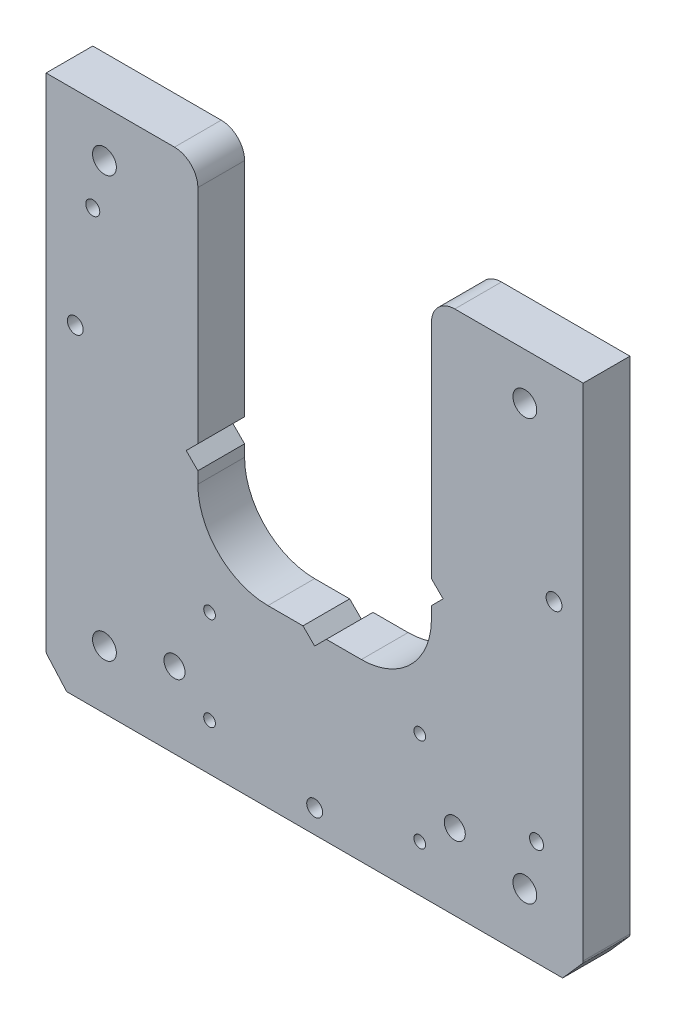
from build123d import *

# Parameters (mm, degrees)
BOSS_EXTRUDE2_DEPTH          = 20
CUT_EXTRUDE2_DEPTH           = 260.084928161
F_5_0_5_DIAMETER_HOLE2_D     = 5
F_5_0_5_DIAMETER_HOLE2_DEPTH = 15
F_5_0_5_DIAMETER_HOLE2_TIP   = 1.502151548
F_6_0_6_DIAMETER_HOLE2_D     = 6
F_10_2_10_2_DIAMETER_HOLE2_D = 10.2
F_15_0_15_DIAMETER_HOLE2_D   = 15
F_6_8_6_8_DIAMETER_HOLE2_D   = 6.8
F_9_0_9_DIAMETER_HOLE2_D     = 9
SKETCH32_R                   = 300
SKETCH32_W                   = 230
SKETCH32_H                   = 230
CUT_EXTRUDE3_DEPTH           = 260.084928161


with BuildPart() as part:
    # Sketch18 → Boss-Extrude2 (new body)
    with BuildSketch(Plane(origin=(0, 0, 0), x_dir=(-1, 0, 0), z_dir=(0, 0, -1))):
        with BuildLine():
            Line((20, -40), (-20, -40))
            ThreePointArc((-20, -40), (-41.213203436, -31.213203436), (-50, -10))
            Line((-50, -10), (-50, -5))
            Line((-50, -5), (-55, 0))
            Line((-55, 0), (-50, 5))
            Line((-50, 5), (-50, 100))
            ThreePointArc((-50, 100), (-52.928932188, 107.071067812), (-60, 110))
            Line((-60, 110), (-165, 110))
            ThreePointArc((-165, 110), (-172.071067812, 107.071067812), (-175, 100))
            Line((-175, 100), (-175, 40))
            ThreePointArc((-175, 40), (-172.071067812, 32.928932188), (-165, 30))
            Line((-165, 30), (-155, 30))
            ThreePointArc((-155, 30), (-126.715728753, 18.284271247), (-115, -10))
            Line((-115, -10), (-115, -104.24379092))
            ThreePointArc((-115, -104.24379092), (-114.870742021, -104.951126971), (-114.499675711, -105.567034195))
            Line((-114.499675711, -105.567034195), (-40.597138287, -189.323243274))
            ThreePointArc((-40.597138287, -189.323243274), (-39.920114828, -189.822976488), (-39.097462577, -190))
            Line((-39.097462577, -190), (39.097462577, -190))
            ThreePointArc((39.097462577, -190), (39.920114828, -189.822976488), (40.597138287, -189.323243274))
            Line((40.597138287, -189.323243274), (114.499675711, -105.567034195))
            ThreePointArc((114.499675711, -105.567034195), (114.870742021, -104.951126971), (115, -104.24379092))
            Line((115, -104.24379092), (115, -10))
            ThreePointArc((115, -10), (126.715728753, 18.284271247), (155, 30))
            Line((155, 30), (165, 30))
            ThreePointArc((165, 30), (172.071067812, 32.928932188), (175, 40))
            Line((175, 40), (175, 100))
            ThreePointArc((175, 100), (172.071067812, 107.071067812), (165, 110))
            Line((165, 110), (60, 110))
            ThreePointArc((60, 110), (52.928932188, 107.071067812), (50, 100))
            Line((50, 100), (50, 5))
            Line((50, 5), (55, 0))
            Line((55, 0), (50, -5))
            Line((50, -5), (50, -10))
            ThreePointArc((50, -10), (41.213203436, -31.213203436), (20, -40))
        make_face()
    extrude(amount=-BOSS_EXTRUDE2_DEPTH)

    # Sketch19 → Cut-Extrude2 (cut, through all)
    with BuildSketch(Plane(origin=(0, 0, 0), x_dir=(-1, 0, 0), z_dir=(0, 0, -1))):
        Polygon((-5, -40), (0, -45), (5, -40), align=None)
    extrude(amount=-CUT_EXTRUDE2_DEPTH, mode=Mode.SUBTRACT)

    # Ø5.0 (5) Diameter Hole2
    with Locations(Plane.XY.offset(20)):
        with Locations((45, -55), (-45, -55), (-45, -95), (45, -95)):
            Hole(F_5_0_5_DIAMETER_HOLE2_D / 2, depth=F_5_0_5_DIAMETER_HOLE2_DEPTH)
            with Locations((0, 0, -(F_5_0_5_DIAMETER_HOLE2_DEPTH + F_5_0_5_DIAMETER_HOLE2_TIP / 2))):  # 118° drill point
                Cone(0, F_5_0_5_DIAMETER_HOLE2_D / 2, F_5_0_5_DIAMETER_HOLE2_TIP, mode=Mode.SUBTRACT)

    # Ø6.0 (6) Diameter Hole2 (through all)
    with Locations(Plane(origin=(0, 0, 0), x_dir=(-1, 0, 0), z_dir=(0, 0, -1))):
        with Locations((95, 70), (-95, -70)):
            Hole(F_6_0_6_DIAMETER_HOLE2_D / 2)

    # Ø10.2 (10.2) Diameter Hole2 (through all)
    with Locations(Plane(origin=(0, 0, 0), x_dir=(-1, 0, 0), z_dir=(0, 0, -1))):
        with Locations((-90, -90), (90, -90), (-90, 90), (90, 90)):
            Hole(F_10_2_10_2_DIAMETER_HOLE2_D / 2)

    # Ø15.0 (15) Diameter Hole2 (through all)
    with Locations(Plane(origin=(0, 0, 0), x_dir=(-1, 0, 0), z_dir=(0, 0, -1))):
        with Locations((0, -150), (-135, 60), (135, 60)):
            Hole(F_15_0_15_DIAMETER_HOLE2_D / 2)

    # Ø6.8 (6.8) Diameter Hole2 (through all)
    with Locations(Plane(origin=(0, 0, 0), x_dir=(-1, 0, 0), z_dir=(0, 0, -1))):
        with Locations((102.5, 22.75), (0, -105), (-102.5, 22.75)):
            Hole(F_6_8_6_8_DIAMETER_HOLE2_D / 2)

    # Ø9.0 (9) Diameter Hole2 (through all)
    with Locations(Plane(origin=(0, 0, 0), x_dir=(-1, 0, 0), z_dir=(0, 0, -1))):
        with Locations((60, -82.5), (-60, -82.5), (120, 95), (-120, 95)):
            Hole(F_9_0_9_DIAMETER_HOLE2_D / 2)

    # Sketch32 → Cut-Extrude3 (cut, through all)
    with BuildSketch(Plane.XY):
        Circle(SKETCH32_R)
        Rectangle(SKETCH32_W, SKETCH32_H, mode=Mode.SUBTRACT)
    extrude(amount=CUT_EXTRUDE3_DEPTH, mode=Mode.SUBTRACT)


solid = part.part
